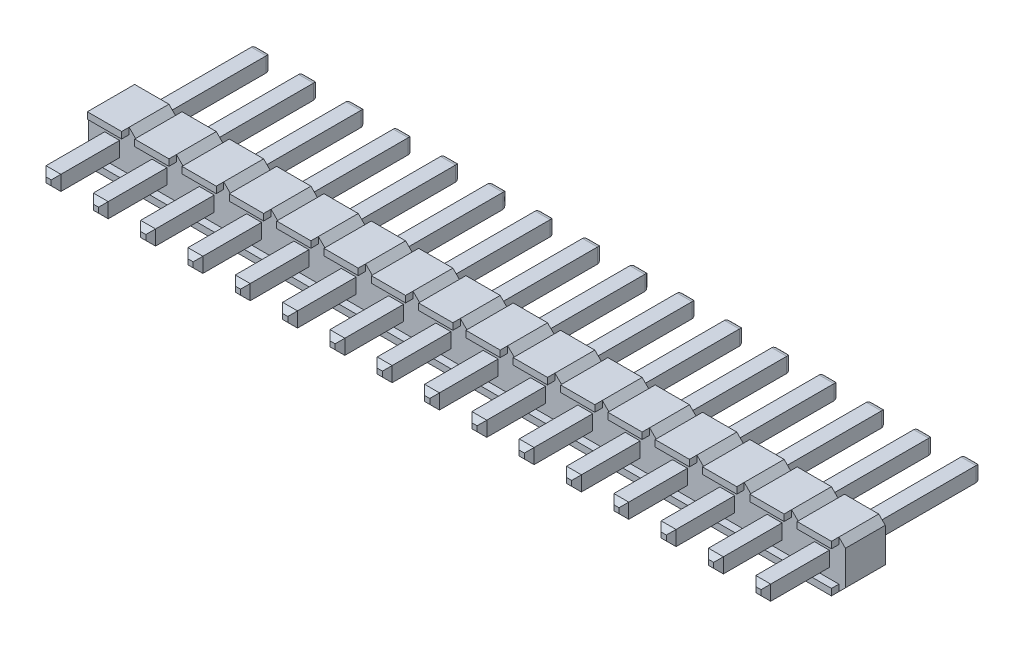
from build123d import *

# Parameters (mm, degrees)
SKETCH1_W                 = 0.8
SKETCH1_H                 = 0.800000001
BOSS_EXTRUDE1_DEPTH       = 2.14
SKETCH4_W                 = 1.84
SKETCH4_H                 = 0.35
BOSS_EXTRUDE2_DEPTH       = 0.4
SKETCH12_W                = 0.8
SKETCH12_H                = 0.8
BOSS_EXTRUDE3_DEPTH       = 11.54
FILLET1_SIZE              = 0.26
FILLET2_R                 = 0.26
LPATTERN9_COUNT           = 16
LPATTERN9_PITCH           = 2.54
FILLET1_OF_LPATTERN9_SIZE = 0.26
FILLET2_OF_LPATTERN9_R    = 0.26


with BuildPart() as part:
    # Sketch1 → Boss-Extrude1 (new body)
    with BuildSketch(Plane.XY):
        Polygon((1.269999999, 0.92), (0.92, 1.27), (-0.92, 1.27), (-1.27, 0.919999999), (-1.27, -0.92), (-0.92, -1.27), (0.919999999, -1.27), (1.269999999, -0.92), align=None)
        with Locations((0.006163489, 0.000250513)):
            Rectangle(SKETCH1_W, SKETCH1_H, mode=Mode.SUBTRACT)
    boss_extrude1 = extrude(amount=BOSS_EXTRUDE1_DEPTH)

    # Sketch4 → Boss-Extrude2 (add)
    with BuildSketch(Plane.XY.offset(2.14)):
        with Locations((0, 1.095)):
            Rectangle(SKETCH4_W, SKETCH4_H)
        Polygon((-0.92, -0.92), (-0.92, -1.27), (0.919999999, -1.27), (0.92, -0.92), align=None)
    boss_extrude2 = extrude(amount=BOSS_EXTRUDE2_DEPTH)

    # Sketch12 → Boss-Extrude3 (add)
    with BuildSketch(Plane(origin=(0, 0, -6), x_dir=(-1, 0, 0), z_dir=(0, 0, -1))):
        with Locations((0, -0.008450004)):
            Rectangle(SKETCH12_W, SKETCH12_H)
    boss_extrude3 = extrude(amount=-BOSS_EXTRUDE3_DEPTH)

    # Fillet1
    fillet1_edges = [part.edges().sort_by_distance(p)[0] for p in [
        (0, 0.391549996, 5.54),
        (0.4, -0.008450004, 5.54),
        (0, -0.408450004, 5.54),
        (-0.4, -0.008450004, 5.54),
    ]]
    chamfer(fillet1_edges, length=FILLET1_SIZE)

    # Fillet2
    fillet2_edges = [part.edges().sort_by_distance(p)[0] for p in [
        (0, -0.408450004, -6),
        (0.4, -0.008450004, -6),
        (0, 0.391549996, -6),
        (-0.4, -0.008450004, -6),
    ]]
    fillet(fillet2_edges, radius=FILLET2_R)

    # LPattern9: Boss-Extrude1, Boss-Extrude2, Boss-Extrude3 ×16
    with Locations(*[(i * LPATTERN9_PITCH, 0, 0) for i in range(1, LPATTERN9_COUNT)]):
        add(boss_extrude1)
        add(boss_extrude2)
        add(boss_extrude3)

    # Fillet1 of LPattern9
    fillet1_of_lpattern9_edges = [part.edges().sort_by_distance(p)[0] for p in [
        (2.54, 0.391549996, 5.54),
        (2.94, -0.008450004, 5.54),
        (2.54, -0.408450004, 5.54),
        (2.14, -0.008450004, 5.54),
        (5.08, 0.391549996, 5.54),
        (5.48, -0.008450004, 5.54),
        (5.08, -0.408450004, 5.54),
        (4.68, -0.008450004, 5.54),
        (7.62, 0.391549996, 5.54),
        (8.02, -0.008450004, 5.54),
        (7.62, -0.408450004, 5.54),
        (7.22, -0.008450004, 5.54),
        (10.16, 0.391549996, 5.54),
        (10.56, -0.008450004, 5.54),
        (10.16, -0.408450004, 5.54),
        (9.76, -0.008450004, 5.54),
        (12.7, 0.391549996, 5.54),
        (13.1, -0.008450004, 5.54),
        (12.7, -0.408450004, 5.54),
        (12.3, -0.008450004, 5.54),
        (15.24, 0.391549996, 5.54),
        (15.64, -0.008450004, 5.54),
        (15.24, -0.408450004, 5.54),
        (14.84, -0.008450004, 5.54),
        (17.78, 0.391549996, 5.54),
        (18.18, -0.008450004, 5.54),
        (17.78, -0.408450004, 5.54),
        (17.38, -0.008450004, 5.54),
        (20.32, 0.391549996, 5.54),
        (20.72, -0.008450004, 5.54),
        (20.32, -0.408450004, 5.54),
        (19.92, -0.008450004, 5.54),
        (22.86, 0.391549996, 5.54),
        (23.26, -0.008450004, 5.54),
        (22.86, -0.408450004, 5.54),
        (22.46, -0.008450004, 5.54),
        (25.4, 0.391549996, 5.54),
        (25.8, -0.008450004, 5.54),
        (25.4, -0.408450004, 5.54),
        (25, -0.008450004, 5.54),
        (27.94, 0.391549996, 5.54),
        (28.34, -0.008450004, 5.54),
        (27.94, -0.408450004, 5.54),
        (27.54, -0.008450004, 5.54),
        (30.48, 0.391549996, 5.54),
        (30.88, -0.008450004, 5.54),
        (30.48, -0.408450004, 5.54),
        (30.08, -0.008450004, 5.54),
        (33.02, 0.391549996, 5.54),
        (33.42, -0.008450004, 5.54),
        (33.02, -0.408450004, 5.54),
        (32.62, -0.008450004, 5.54),
        (35.56, 0.391549996, 5.54),
        (35.96, -0.008450004, 5.54),
        (35.56, -0.408450004, 5.54),
        (35.16, -0.008450004, 5.54),
        (38.1, 0.391549996, 5.54),
        (38.5, -0.008450004, 5.54),
        (38.1, -0.408450004, 5.54),
        (37.7, -0.008450004, 5.54),
    ]]
    chamfer(fillet1_of_lpattern9_edges, length=FILLET1_OF_LPATTERN9_SIZE)

    # Fillet2 of LPattern9
    fillet2_of_lpattern9_edges = [part.edges().sort_by_distance(p)[0] for p in [
        (2.54, -0.408450004, -6),
        (2.94, -0.008450004, -6),
        (2.54, 0.391549996, -6),
        (2.14, -0.008450004, -6),
        (5.08, -0.408450004, -6),
        (5.48, -0.008450004, -6),
        (5.08, 0.391549996, -6),
        (4.68, -0.008450004, -6),
        (7.62, -0.408450004, -6),
        (8.02, -0.008450004, -6),
        (7.62, 0.391549996, -6),
        (7.22, -0.008450004, -6),
        (10.16, -0.408450004, -6),
        (10.56, -0.008450004, -6),
        (10.16, 0.391549996, -6),
        (9.76, -0.008450004, -6),
        (12.7, -0.408450004, -6),
        (13.1, -0.008450004, -6),
        (12.7, 0.391549996, -6),
        (12.3, -0.008450004, -6),
        (15.24, -0.408450004, -6),
        (15.64, -0.008450004, -6),
        (15.24, 0.391549996, -6),
        (14.84, -0.008450004, -6),
        (17.78, -0.408450004, -6),
        (18.18, -0.008450004, -6),
        (17.78, 0.391549996, -6),
        (17.38, -0.008450004, -6),
        (20.32, -0.408450004, -6),
        (20.72, -0.008450004, -6),
        (20.32, 0.391549996, -6),
        (19.92, -0.008450004, -6),
        (22.86, -0.408450004, -6),
        (23.26, -0.008450004, -6),
        (22.86, 0.391549996, -6),
        (22.46, -0.008450004, -6),
        (25.4, -0.408450004, -6),
        (25.8, -0.008450004, -6),
        (25.4, 0.391549996, -6),
        (25, -0.008450004, -6),
        (27.94, -0.408450004, -6),
        (28.34, -0.008450004, -6),
        (27.94, 0.391549996, -6),
        (27.54, -0.008450004, -6),
        (30.48, -0.408450004, -6),
        (30.88, -0.008450004, -6),
        (30.48, 0.391549996, -6),
        (30.08, -0.008450004, -6),
        (33.02, -0.408450004, -6),
        (33.42, -0.008450004, -6),
        (33.02, 0.391549996, -6),
        (32.62, -0.008450004, -6),
        (35.56, -0.408450004, -6),
        (35.96, -0.008450004, -6),
        (35.56, 0.391549996, -6),
        (35.16, -0.008450004, -6),
        (38.1, -0.408450004, -6),
        (38.5, -0.008450004, -6),
        (38.1, 0.391549996, -6),
        (37.7, -0.008450004, -6),
    ]]
    fillet(fillet2_of_lpattern9_edges, radius=FILLET2_OF_LPATTERN9_R)


solid = part.part
